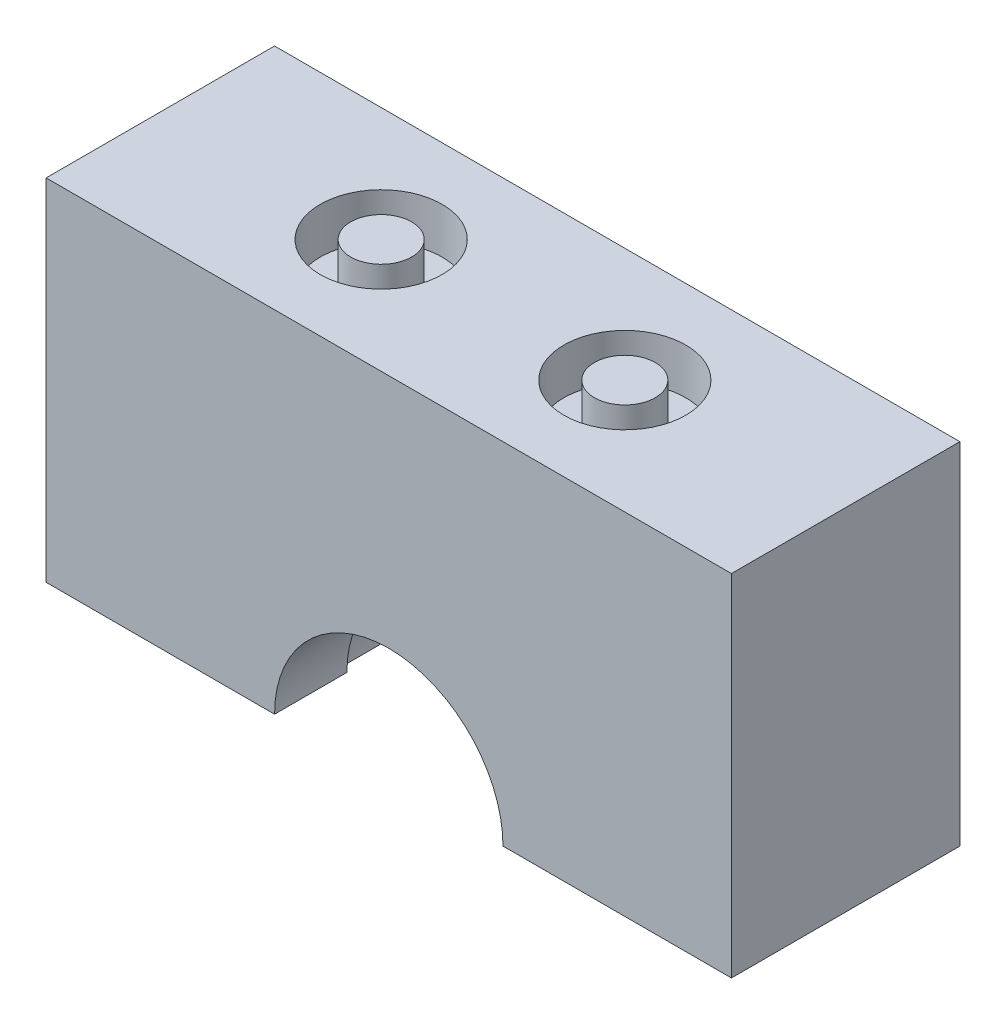
from build123d import *

# Parameters (mm, degrees)
BOSS_EXTRUDE1_DEPTH = 15
SKETCH2_W           = 5.5
SKETCH2_H           = 1.517546376
SKETCH3_R           = 4
SKETCH3_R_2         = 2
CUT_EXTRUDE1_DEPTH  = 3


with BuildPart() as part:
    # Sketch1 → Boss-Extrude1 (new body)
    with BuildSketch(Plane.XY):
        with BuildLine():
            Line((-22.5, 23), (-22.5, 0))
            Line((-22.5, 0), (-7.5, 0))
            ThreePointArc((-7.5, 0), (0, 7.5), (7.5, 0))
            Line((7.5, 0), (22.5, 0))
            Line((22.5, 0), (22.5, 23))
            Line((22.5, 23), (-22.5, 23))
        make_face()
    extrude(amount=BOSS_EXTRUDE1_DEPTH)

    # Sketch2 → Cut-Revolve2 (revolve, cut)
    with BuildSketch(Plane(origin=(0, 0, 0), x_dir=(0, 0, -1), z_dir=(1, 0, 0))):
        with Locations((-7.5, 7.241226812)):
            Rectangle(SKETCH2_W, SKETCH2_H)
    revolve(axis=Axis((0, 0, 0), (0, 0, 1)), mode=Mode.SUBTRACT)

    # Sketch3 → Cut-Extrude1 (cut)
    # profile 1 of 2: a face of its own
    with BuildSketch(Plane(origin=(0, 23, 0), x_dir=(1, 0, 0), z_dir=(0, 1, 0))):
        with Locations((-8, -7.5)):
            Circle(SKETCH3_R)
        with Locations((-8, -7.5)):
            Circle(SKETCH3_R_2, mode=Mode.SUBTRACT)
    # profile 2 of 2: a face of its own
    with BuildSketch(Plane(origin=(0, 23, 0), x_dir=(1, 0, 0), z_dir=(0, 1, 0))):
        with Locations((8, -7.5)):
            Circle(SKETCH3_R)
        with Locations((8, -7.5)):
            Circle(SKETCH3_R_2, mode=Mode.SUBTRACT)
    extrude(amount=-CUT_EXTRUDE1_DEPTH, mode=Mode.SUBTRACT)


solid = part.part
